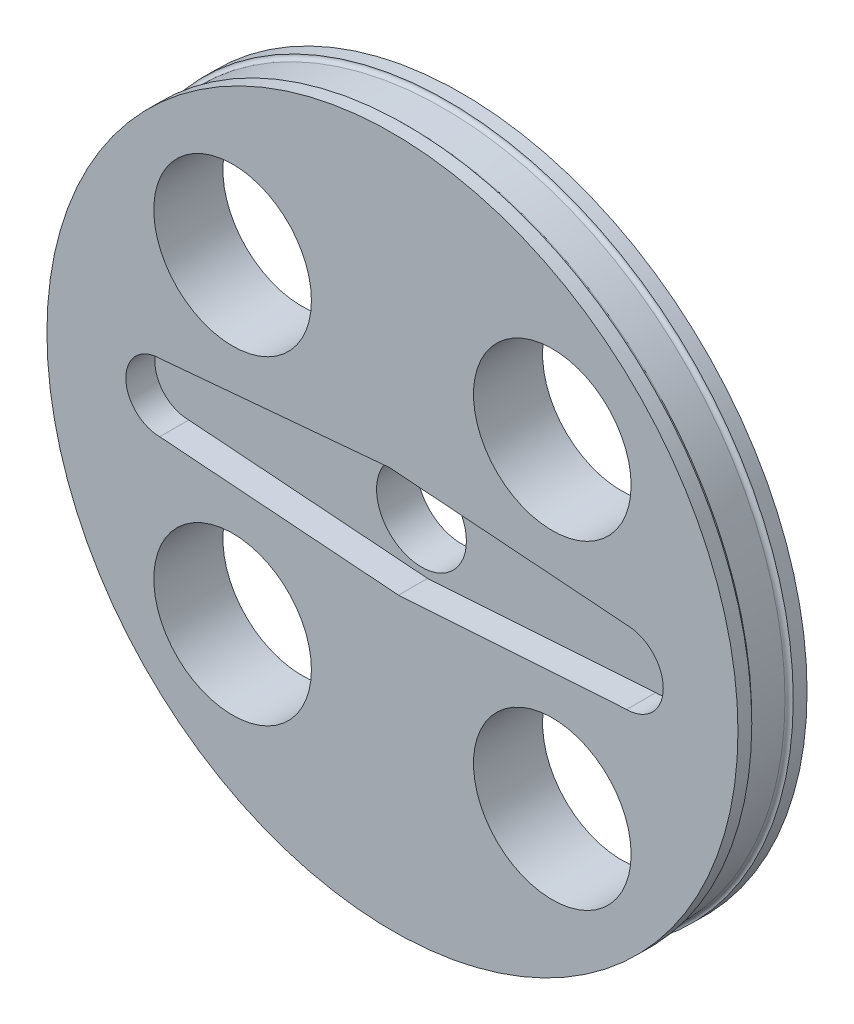
from build123d import *

# Parameters (mm, degrees)
SKETCH1_R           = 25
BOSS_EXTRUDE1_DEPTH = 5
FILLET1_R           = 0.3
CUT_EXTRUDE1_DEPTH  = 2.1
SKETCH15_R          = 3.25
CUT_EXTRUDE2_DEPTH  = 10.1
SKETCH18_R          = 5.702447769
CUT_EXTRUDE4_DEPTH  = 10.1


with BuildPart() as part:
    # Sketch1 → Boss-Extrude1 (new body)
    with BuildSketch(Plane.XY):
        with Locations((-38.308088976, 20.909831899)):
            Circle(SKETCH1_R)
    extrude(amount=BOSS_EXTRUDE1_DEPTH)

    # Sketch12 → Cut-Revolve1 (revolve, cut)
    with BuildSketch(Plane.ZY.offset(38.308088976), mode=Mode.PRIVATE) as cut_revolve1_sk:
        Polygon((2.5, 45.909831899), (4, 45.909831899), (4, 45.609831899), (2.5, 45.609831899), (1, 45.609831899), (1, 45.909831899), align=None)
    revolve(cut_revolve1_sk.sketch.rotate(Axis((-38.308088976, 20.909831899, 0), (0, 0, 1)), 90), axis=Axis((-38.308088976, 20.909831899, 0), (0, 0, 1)), mode=Mode.SUBTRACT)

    # Fillet1
    fillet1_edges = [part.edges().sort_by_distance(p)[0] for p in [
        (-13.608088976, 20.909831899, 1),
        (-13.608088976, 20.909831899, 4),
    ]]
    fillet(fillet1_edges, radius=FILLET1_R - 0.0001)  # a hair under: the kernel refuses the full size

    # Sketch13 → Cut-Extrude1 (cut)
    with BuildSketch(Plane.XY.offset(5)):
        with BuildLine():
            Line((-38.537840804, 24.839400282), (-55.145400599, 23.363683745))
            ThreePointArc((-55.145400599, 23.363683745), (-57.599252444, 20.909831899), (-55.145400599, 18.455980054))
            Line((-55.145400599, 18.455980054), (-37.86715674, 17.168664797))
            Line((-37.86715674, 17.168664797), (-21.363574888, 18.259831899))
            ThreePointArc((-21.363574888, 18.259831899), (-18.713574888, 20.909831899), (-21.363574888, 23.559831899))
            Line((-21.363574888, 23.559831899), (-38.537840804, 24.839400282))
        make_face()
    extrude(amount=-CUT_EXTRUDE1_DEPTH, mode=Mode.SUBTRACT)

    # Sketch15 → Cut-Extrude2 (cut)
    with BuildSketch(Plane.XY.offset(2.9)):
        with Locations((-38.308088976, 20.909831899)):
            Circle(SKETCH15_R)
    extrude(amount=-CUT_EXTRUDE2_DEPTH, mode=Mode.SUBTRACT)

    # Sketch18 → Cut-Extrude4 (cut)
    with BuildSketch(Plane.XY.offset(5)):
        with Locations((-26.7425748, 32.475346075)):
            Circle(SKETCH18_R)
        with Locations((-26.7425748, 9.344317724)):
            Circle(SKETCH18_R)
        with Locations((-49.873603152, 9.344317724)):
            Circle(SKETCH18_R)
        with Locations((-49.873603152, 32.475346075)):
            Circle(SKETCH18_R)
    extrude(amount=-CUT_EXTRUDE4_DEPTH, mode=Mode.SUBTRACT)


solid = part.part
